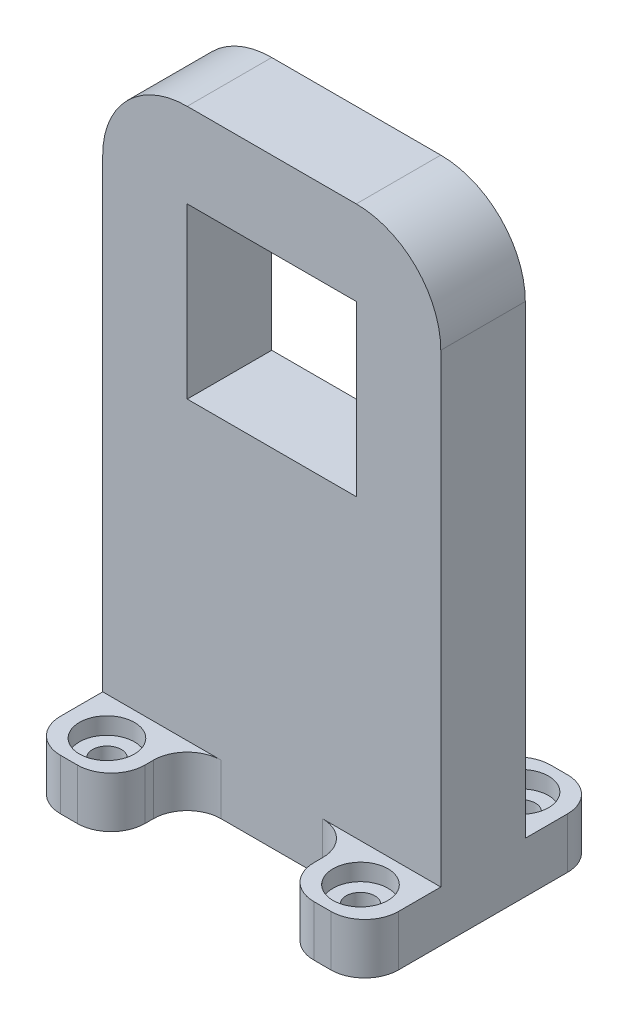
from build123d import *

# Parameters (mm, degrees)
ESQUISSE1_W                                          = 40
ESQUISSE1_H                                          = 71
ESQUISSE1_W_2                                        = 20
ESQUISSE1_H_2                                        = 20
BOSS_EXTRU_1_DEPTH                                   = 10
ESQUISSE3_W                                          = 10
ESQUISSE3_H                                          = 6
BOSS_EXTRU_2_DEPTH                                   = 9
CHAMBRAGE_POUR_T_TE_CYLINDRIQUE_FENDUE_M_D           = 3.4
CHAMBRAGE_POUR_T_TE_CYLINDRIQUE_FENDUE_M_CBORE_D     = 6.5
CHAMBRAGE_POUR_T_TE_CYLINDRIQUE_FENDUE_M_CBORE_DEPTH = 2
CONG_1_R                                             = 4
CONG_2_R                                             = 10


with BuildPart() as part:
    # Esquisse1 → Boss.-Extru.1 (new body)
    with BuildSketch(Plane.XY):
        with Locations((20, 35.5)):
            Rectangle(ESQUISSE1_W, ESQUISSE1_H)
        with Locations((20, 51)):
            Rectangle(ESQUISSE1_W_2, ESQUISSE1_H_2, mode=Mode.SUBTRACT)
    extrude(amount=BOSS_EXTRU_1_DEPTH)

    # Esquisse3 → Boss.-Extru.2 (add)
    with BuildSketch(Plane.XY.offset(10)):
        with Locations((35, 3)):
            Rectangle(ESQUISSE3_W, ESQUISSE3_H)
        with Locations((5, 3)):
            Rectangle(ESQUISSE3_W, ESQUISSE3_H)
    boss_extru_2 = extrude(amount=BOSS_EXTRU_2_DEPTH)

    # Chambrage pour tête cylindrique fendue M31 (through all)
    with Locations(Plane(origin=(0, 6, 0), x_dir=(1, 0, 0), z_dir=(0, 1, 0))):
        with Locations((5, -14.5), (35, -14.5)):
            chambrage_pour_t_te_cylindrique_fendue_m = CounterBoreHole(CHAMBRAGE_POUR_T_TE_CYLINDRIQUE_FENDUE_M_D / 2, CHAMBRAGE_POUR_T_TE_CYLINDRIQUE_FENDUE_M_CBORE_D / 2, CHAMBRAGE_POUR_T_TE_CYLINDRIQUE_FENDUE_M_CBORE_DEPTH)

    # Symétrie1: Boss.-Extru.2, Chambrage pour tête cylindrique fendue M31 across plane
    add(boss_extru_2.mirror(Plane.XY.offset(5)))
    add(chambrage_pour_t_te_cylindrique_fendue_m.mirror(Plane.XY.offset(5)), mode=Mode.SUBTRACT)

    # Congé1
    cong_1_edges = [part.edges().sort_by_distance(p)[0] for p in [
        (40, 3, 19),
        (30, 3, 19),
        (0, 3, 19),
        (10, 3, 19),
        (30, 3, 10),
        (10, 3, 10),
        (0, 3, -9),
        (10, 3, -9),
        (10, 3, 0),
        (30, 3, 0),
        (30, 3, -9),
        (40, 3, -9),
    ]]
    fillet(cong_1_edges, radius=CONG_1_R)

    # Congé2
    cong_2_edges = [part.edges().sort_by_distance(p)[0] for p in [
        (0, 71, 5),
        (40, 71, 5),
    ]]
    fillet(cong_2_edges, radius=CONG_2_R)


solid = part.part
